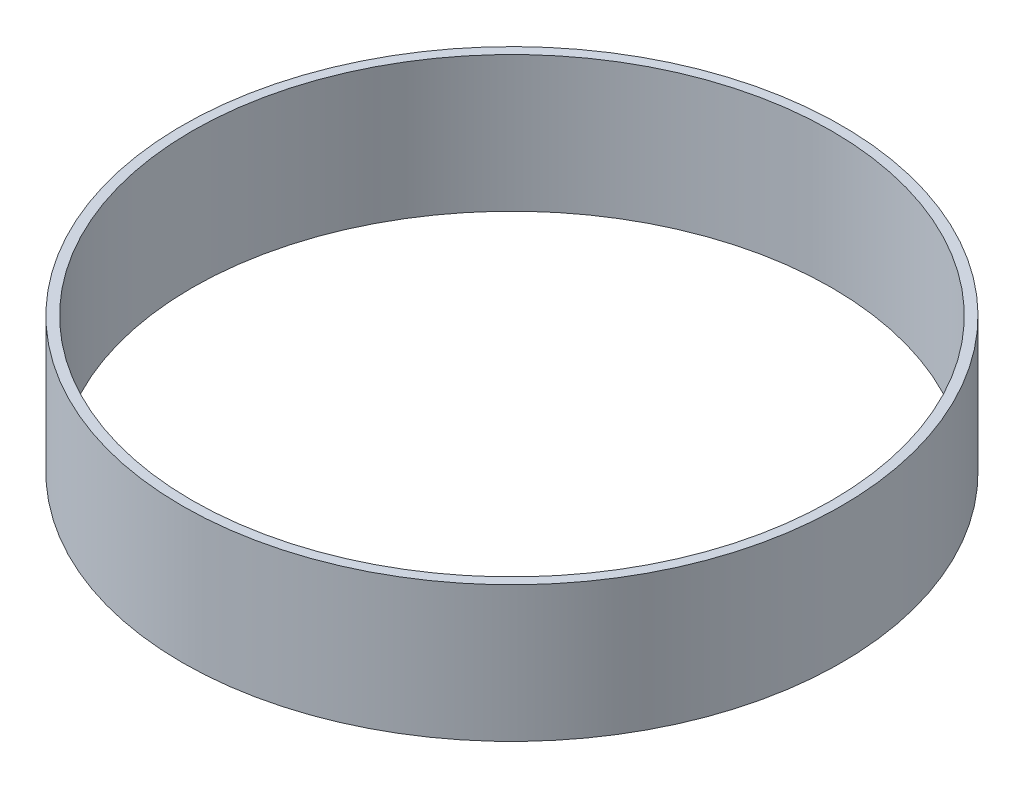
from build123d import *

# Parameters (mm, degrees)
SKETCH1_W = 1
SKETCH1_H = 14


with BuildPart() as part:
    # Sketch1 → Revolve1 (revolve)
    with BuildSketch(Plane.XY):
        with Locations((-33.5, 0)):
            Rectangle(SKETCH1_W, SKETCH1_H)
    revolve(axis=Axis((0, 0, 0), (0, -1, 0)))


solid = part.part
